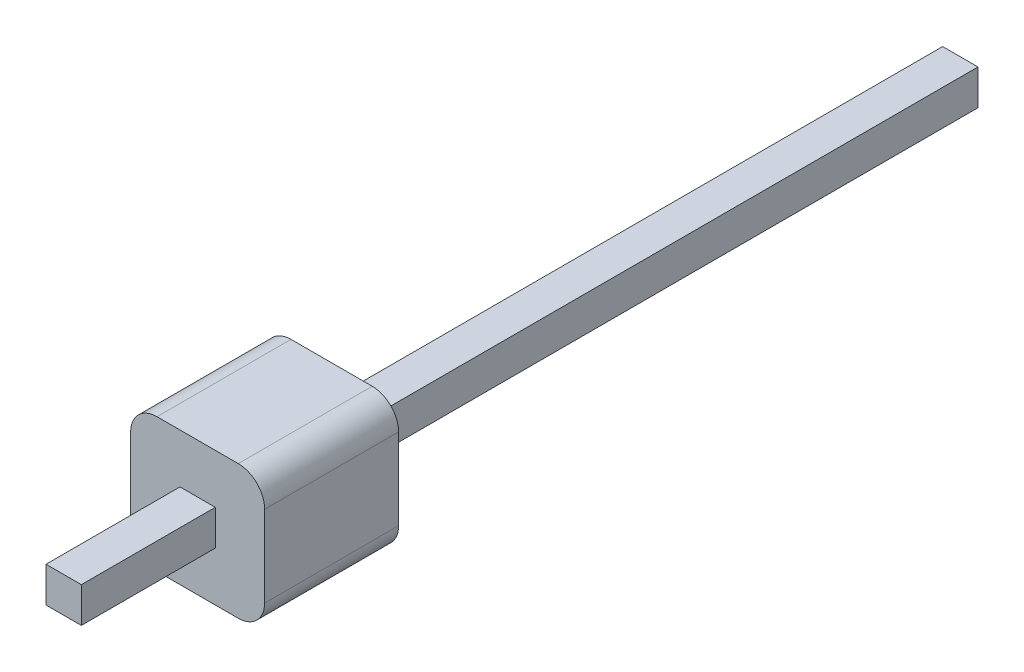
from build123d import *

# Parameters (mm, degrees)
SKETCH_1_W      = 2.54
SKETCH_1_H      = 2.54
EXTRUDE_1_DEPTH = 2.54
SKETCH_2_W      = 0.67
SKETCH_2_H      = 0.67
FILLET_1_R      = 0.5


with BuildPart() as part:
    # 草图1 → 拉伸1 (new body)
    with BuildSketch(Plane.XY):
        with Locations((0, -1.289090726)):
            Rectangle(SKETCH_1_W, SKETCH_1_H)
    extrude(amount=EXTRUDE_1_DEPTH)

    # 扫描1: sweep along a path in 草图3
    with BuildLine(Plane(origin=(0, 0, 0), x_dir=(0, 0, -1), z_dir=(1, 0, 0))) as sweep_1_path:
        Line((11.92, -1.299090726), (-5.08, -1.299090726))
    # 草图2 → 扫描1 (sweep)
    with BuildSketch(Plane(origin=(0, 0, 5.08), x_dir=(-1, 0, 0), z_dir=(0, 0, -1))):
        with Locations((0, -1.289090726)):
            Rectangle(SKETCH_2_W, SKETCH_2_H)
    sweep(path=sweep_1_path.line)

    # 圆角1
    fillet_1_edges = [part.edges().sort_by_distance(p)[0] for p in [
        (1.27, -0.019090726, 1.27),
        (1.27, -2.559090726, 1.27),
        (-1.27, -2.559090726, 1.27),
        (-1.27, -0.019090726, 1.27),
    ]]
    fillet(fillet_1_edges, radius=FILLET_1_R)


solid = part.part
